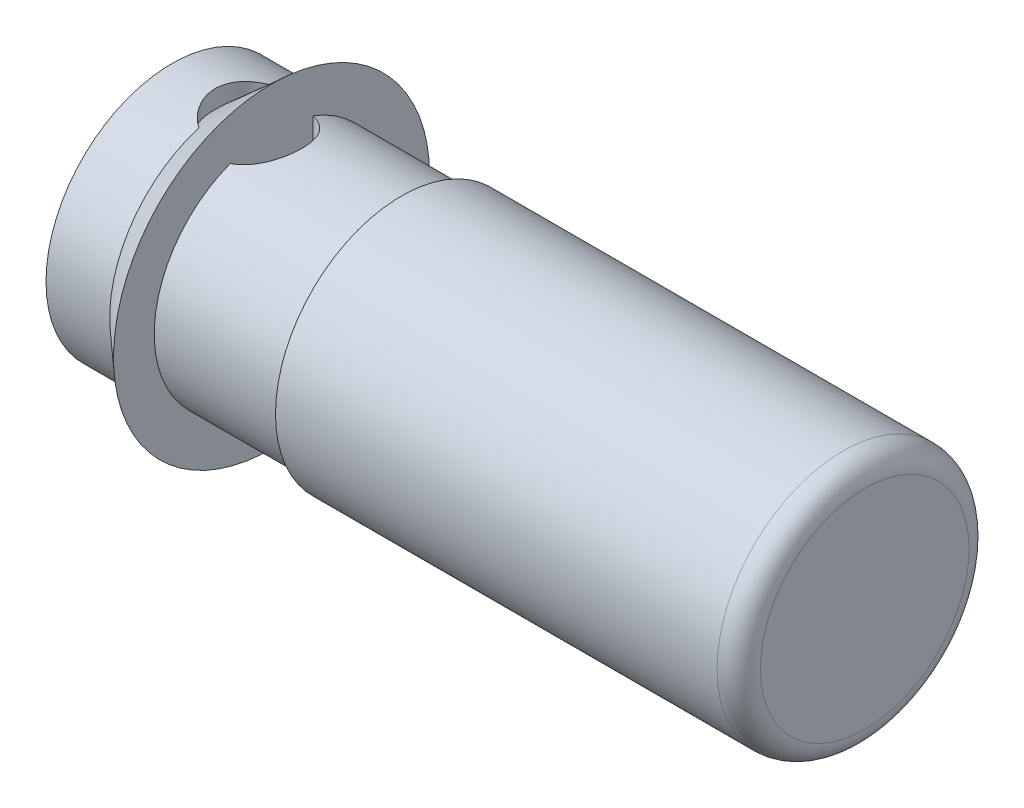
from build123d import *

# Parameters (mm, degrees)
SKETCH2_R               = 1.455
BOSS_EXTRUDE3_DEPTH     = 6
SKETCH3_R               = 2.5
BOSS_EXTRUDE4_DEPTH     = 3
CUT_EXTRUDE1_DEPTH      = 10.669539803
CUT_EXTRUDE1_DEPTH_BACK = 10.669539803
SKETCH4_R               = 0.5
SKETCH6_R               = 1.575
BOSS_EXTRUDE5_DEPTH     = 0.15
CUT_EXTRUDE3_REACH      = 11.67
SKETCH9_R               = 2.5
SKETCH9_R_2             = 1.455
CUT_EXTRUDE4_START      = -1
SKETCH10_R              = 1.455
CUT_EXTRUDE4_DEPTH      = 1
FILLET1_R               = 0.25
SKETCH11_R              = 1.455
SKETCH11_R_2            = 1.355
CUT_EXTRUDE5_DEPTH      = 1.5


with BuildPart() as part:
    # Sketch2 → Boss-Extrude3 (new body)
    with BuildSketch(Plane(origin=(0, 0, 0), x_dir=(0, 0, -1), z_dir=(1, 0, 0))):
        Circle(SKETCH2_R)
    extrude(amount=BOSS_EXTRUDE3_DEPTH)

    # Sketch3 → Boss-Extrude4 (add)
    with BuildSketch(Plane(origin=(6, 0, 0), x_dir=(0, 0, -1), z_dir=(1, 0, 0))):
        Circle(SKETCH3_R)
    extrude(amount=BOSS_EXTRUDE4_DEPTH)

    # Sketch4 → Cut-Extrude1 (cut, two sides: drawn at the far end of the back side and taken through both)
    with BuildSketch(Plane(origin=(0, 0, 0), x_dir=(1, 0, 0), z_dir=(0, 1, 0)).offset(-CUT_EXTRUDE1_DEPTH_BACK)):
        with Locations((1, 0)):
            Circle(SKETCH4_R)
    extrude(amount=CUT_EXTRUDE1_DEPTH + CUT_EXTRUDE1_DEPTH_BACK, mode=Mode.SUBTRACT)

    # Sketch6 → Boss-Extrude5 (add)
    with BuildSketch(Plane.YZ.offset(1)):
        Circle(SKETCH6_R)
    extrude(amount=BOSS_EXTRUDE5_DEPTH)

    # Sketch7 → Revolve1 (revolve)
    with BuildSketch(Plane.XY):
        Polygon((1.15, 1.825), (0, 0.8), (1.15, 0.8), align=None)
    revolve(axis=Axis((9.45, 0, 0), (-1, 0, 0)))

    # Sketch9 → Cut-Extrude3 (cut, up to next)
    with BuildSketch(Plane(origin=(9, 0, 0), x_dir=(0, 0, -1), z_dir=(1, 0, 0)), mode=Mode.PRIVATE) as cut_extrude3_sk1:
        Circle(SKETCH9_R)
        Circle(SKETCH9_R_2, mode=Mode.SUBTRACT)
    cut_extrude3_tool1 = extrude(cut_extrude3_sk1.sketch, amount=-CUT_EXTRUDE3_REACH, mode=Mode.PRIVATE) & part.part
    add(cut_extrude3_tool1.solids().sort_by_distance((9, 0, 2.429289))[0], mode=Mode.SUBTRACT)

    # Sketch10 → Cut-Extrude4 (cut)
    with BuildSketch(Plane(origin=(9, 0, 0), x_dir=(0, 0, -1), z_dir=(1, 0, 0)).offset(CUT_EXTRUDE4_START)):
        Circle(SKETCH10_R)
    extrude(amount=CUT_EXTRUDE4_DEPTH, mode=Mode.SUBTRACT)

    # Fillet1
    fillet1_edges = [part.edges().sort_by_distance(p)[0] for p in [
        (8, 0, 1.455),
    ]]
    fillet(fillet1_edges, radius=FILLET1_R)

    # Sketch11 → Cut-Extrude5 (cut)
    with BuildSketch(Plane(origin=(1.15, 0, 0), x_dir=(0, 0, -1), z_dir=(1, 0, 0))):
        Circle(SKETCH11_R)
        Circle(SKETCH11_R_2, mode=Mode.SUBTRACT)
    extrude(amount=CUT_EXTRUDE5_DEPTH, mode=Mode.SUBTRACT)


solid = part.part
